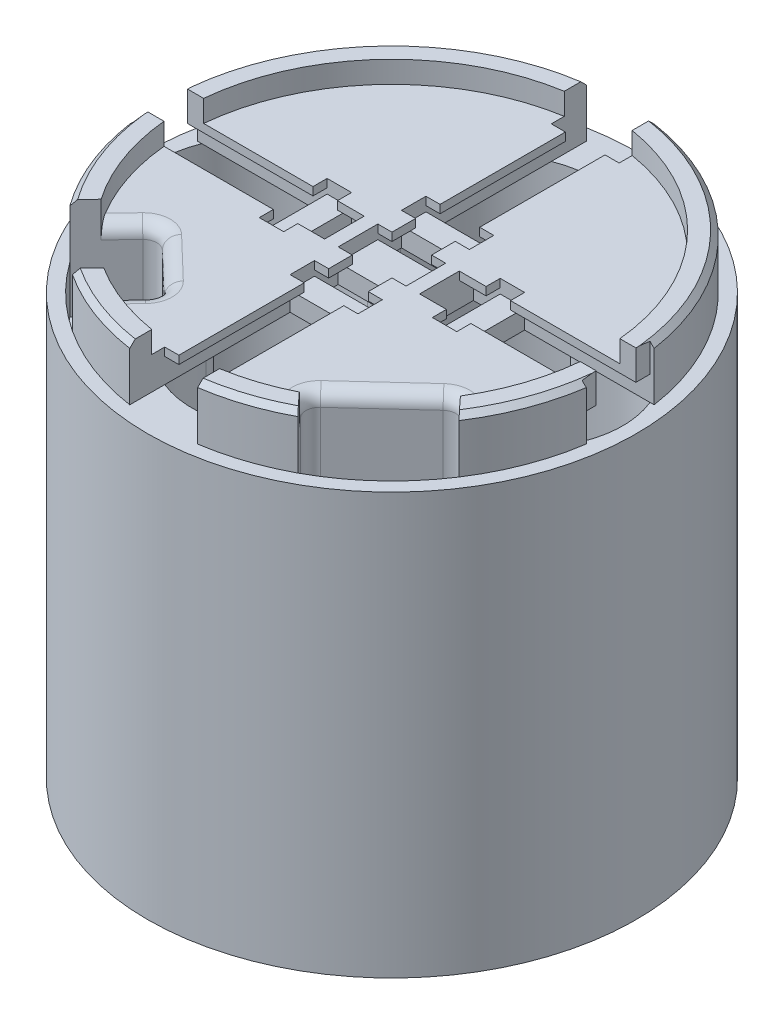
from build123d import *

# Parameters (mm, degrees)
CHAMFER1_SIZE                  = 0.508
CUT_EXTRUDE1_REACH             = 54.93
CUT_EXTRUDE1_DIRECTION_2_REACH = 54.93
CIRPATTERN1_COUNT              = 2
CIRPATTERN1_ANGLE              = 90
CUT_EXTRUDE7_DEPTH             = 36.83
SKETCH12_W                     = 2.286
SKETCH12_H                     = 6.35
SKETCH12_W_2                   = 6.35
SKETCH12_H_2                   = 2.286
BOSS_EXTRUDE2_DEPTH            = 1.778
CIRPATTERN2_COUNT              = 2
BOSS_EXTRUDE3_REACH            = 52.943
SKETCH15_W                     = 1.27
SKETCH15_H                     = 6.35
CIRPATTERN3_COUNT              = 2
CUT_EXTRUDE9_START             = -2.794
SKETCH16_W                     = 2.286
SKETCH16_H                     = 6.35
SKETCH16_W_2                   = 6.35
SKETCH16_H_2                   = 2.286
CUT_EXTRUDE9_DEPTH             = 2.794
CUT_EXTRUDE10_REACH            = 56.963
SKETCH17_W                     = 6.35
SKETCH17_H                     = 3.508817221
SKETCH17_W_2                   = 0.624597149
SKETCH17_H_2                   = 6.35
FILLET2_R                      = 1.27
FILLET3_R                      = 1.27
FILLET4_R                      = 1.27
FILLET5_R                      = 1.27
SKETCH18_W                     = 6.35
SKETCH18_H                     = 3.7084
BOSS_EXTRUDE4_DEPTH            = 1.778
CUT_EXTRUDE11_DEPTH            = 34.29
CUT_EXTRUDE12_DEPTH            = 9.525
CHAMFER2_SIZE                  = 0.508
CHAMFER3_SIZE                  = 0.508
SKETCH23_R                     = 19.558
CUT_EXTRUDE16_DEPTH            = 2.032
FILLET8_R                      = 1.27
FILLET9_R                      = 1.27


with BuildPart() as part:
    # Sketch1 → Revolve1 (revolve)
    with BuildSketch(Plane.XY, mode=Mode.PRIVATE) as revolve1_sk:
        Polygon((0, 0), (21.59, 0), (21.59, -2.54), (22.86, -2.54), (22.86, 36.83), (21.59, 36.83), (21.59, 41.91), (0, 41.91), align=None)
    revolve(revolve1_sk.sketch.rotate(Axis((0, 41.91, 0), (0, -1, 0)), 90), axis=Axis((0, 41.91, 0), (0, -1, 0)))

    # Chamfer1
    chamfer1_edges = [part.edges().sort_by_distance(p)[0] for p in [
        (0, 41.91, -21.59),
    ]]
    chamfer(chamfer1_edges, length=CHAMFER1_SIZE)

    # Sketch3 → Cut-Extrude1 (cut, up to next)
    with BuildSketch(Plane.XY, mode=Mode.PRIVATE) as cut_extrude1_sk1:
        Polygon((0, 36.83), (3.175, 36.83), (3.175, 39.116), (1.8542, 39.116), (1.8542, 41.91), (-1.8542, 41.91), (-1.8542, 39.116), (-3.175, 39.116), (-3.175, 36.83), align=None)
    cut_extrude1_tool1 = extrude(cut_extrude1_sk1.sketch, amount=-CUT_EXTRUDE1_REACH, mode=Mode.PRIVATE) & part.part
    cut_extrude1 = cut_extrude1_tool1.solids().sort_by_distance((0, 39.030894, 0))[0]
    add(cut_extrude1, mode=Mode.SUBTRACT)

    # Sketch3 → Cut-Extrude1 direction 2 (cut, up to next)
    with BuildSketch(Plane.XY, mode=Mode.PRIVATE) as cut_extrude1_direction_2_sk1:
        Polygon((0, 36.83), (3.175, 36.83), (3.175, 39.116), (1.8542, 39.116), (1.8542, 41.91), (-1.8542, 41.91), (-1.8542, 39.116), (-3.175, 39.116), (-3.175, 36.83), align=None)
    cut_extrude1_direction_2_tool1 = extrude(cut_extrude1_direction_2_sk1.sketch, amount=CUT_EXTRUDE1_DIRECTION_2_REACH, mode=Mode.PRIVATE) & part.part
    cut_extrude1_direction_2 = cut_extrude1_direction_2_tool1.solids().sort_by_distance((0, 39.030894, 0))[0]
    add(cut_extrude1_direction_2, mode=Mode.SUBTRACT)

    # CirPattern1: Cut-Extrude1, Cut-Extrude1 direction 2 ×2 about axis
    cirpattern1_axis = Axis((0, 41.91, 0), (0, 1, 0))
    add([cut_extrude1.rotate(cirpattern1_axis, i * CIRPATTERN1_ANGLE / (CIRPATTERN1_COUNT - 1)) for i in range(1, CIRPATTERN1_COUNT)], mode=Mode.SUBTRACT)
    add([cut_extrude1_direction_2.rotate(cirpattern1_axis, i * CIRPATTERN1_ANGLE / (CIRPATTERN1_COUNT - 1)) for i in range(1, CIRPATTERN1_COUNT)], mode=Mode.SUBTRACT)

    # Sketch4 → Cut-Extrude7 (cut)
    with BuildSketch(Plane.XZ):
        with BuildLine():
            ThreePointArc((6.604, 5.161889964), (0, 18.705779928), (-6.604, 5.161889964))
            ThreePointArc((-6.604, 5.161889964), (-21.59, 0), (-6.604, -5.161889964))
            ThreePointArc((-6.604, -5.161889964), (0, -18.705779928), (6.604, -5.161889964))
            ThreePointArc((6.604, -5.161889964), (21.59, 0), (6.604, 5.161889964))
        make_face()
    extrude(amount=-CUT_EXTRUDE7_DEPTH, mode=Mode.SUBTRACT)

    # Sketch12 → Boss-Extrude2 (add)
    with BuildSketch(Plane.XZ.offset(-36.83)):
        with Locations((-8.09625, 0)):
            Rectangle(SKETCH12_W, SKETCH12_H)
        with Locations((0, 5.212029928)):
            Rectangle(SKETCH12_W_2, SKETCH12_H_2)
    boss_extrude2 = extrude(amount=-BOSS_EXTRUDE2_DEPTH)

    # CirPattern2: Boss-Extrude2 ×2 about axis
    cirpattern2_axis = Axis((0, 0, 0), (0, 1, 0))
    for i in range(1, CIRPATTERN2_COUNT):
        add(boss_extrude2.rotate(cirpattern2_axis, i * 360 / CIRPATTERN2_COUNT))

    # Boss-Extrude3: up to this face of the body (flat: up to its plane)
    boss_extrude3_end = Plane(part.part.faces().sort_by_distance((-9.763290549, 41.91, 9.763290549))[0])
    # Sketch15 → Boss-Extrude3 (add, up to the picked face)
    with BuildSketch(Plane.XZ.offset(-36.83), mode=Mode.PRIVATE) as boss_extrude3_sk1:
        with Locations((-3.81, 0)):
            Rectangle(SKETCH15_W, SKETCH15_H)
    boss_extrude3_tool1 = split(extrude(boss_extrude3_sk1.sketch, amount=-BOSS_EXTRUDE3_REACH, mode=Mode.PRIVATE), bisect_by=boss_extrude3_end, keep=Keep.BOTH, mode=Mode.PRIVATE)
    boss_extrude3 = boss_extrude3_tool1.solids().sort_by(Axis((-3.81, 36.83, 0), (0, 1, 0)))[0]
    add(boss_extrude3)

    # CirPattern3: Boss-Extrude3 ×2 about axis
    cirpattern3_axis = Axis((0, 41.91, 0), (0, 1, 0))
    for i in range(1, CIRPATTERN3_COUNT):
        add(boss_extrude3.rotate(cirpattern3_axis, i * 360 / CIRPATTERN3_COUNT))

    # Sketch16 → Cut-Extrude9 (cut)
    with BuildSketch(Plane(origin=(0, 41.91, 0), x_dir=(1, 0, 0), z_dir=(0, 1, 0)).offset(CUT_EXTRUDE9_START)):
        with Locations((8.09625, 0)):
            Rectangle(SKETCH16_W, SKETCH16_H)
        with Locations((0, -5.212029928)):
            Rectangle(SKETCH16_W_2, SKETCH16_H_2)
        with Locations((-8.09625, 0)):
            Rectangle(SKETCH16_W, SKETCH16_H)
        with Locations((0, 5.212029928)):
            Rectangle(SKETCH16_W_2, SKETCH16_H_2)
    extrude(amount=CUT_EXTRUDE9_DEPTH, mode=Mode.SUBTRACT)

    # Sketch17 → Cut-Extrude10 (cut, up to next)
    with BuildSketch(Plane(origin=(0, 41.91, 0), x_dir=(1, 0, 0), z_dir=(0, 1, 0)), mode=Mode.PRIVATE) as cut_extrude10_sk1:
        with Locations((0, 19.83559139)):
            Rectangle(SKETCH17_W, SKETCH17_H)
    cut_extrude10_tool1 = extrude(cut_extrude10_sk1.sketch, amount=-CUT_EXTRUDE10_REACH, mode=Mode.PRIVATE) & part.part
    # Sketch17 → Cut-Extrude10 (cut, up to next)
    with BuildSketch(Plane(origin=(0, 41.91, 0), x_dir=(1, 0, 0), z_dir=(0, 1, 0)), mode=Mode.PRIVATE) as cut_extrude10_sk2:
        with Locations((0, -19.83559139)):
            Rectangle(SKETCH17_W, SKETCH17_H)
    cut_extrude10_tool2 = extrude(cut_extrude10_sk2.sketch, amount=-CUT_EXTRUDE10_REACH, mode=Mode.PRIVATE) & part.part
    # Sketch17 → Cut-Extrude10 (cut, up to next)
    with BuildSketch(Plane(origin=(0, 41.91, 0), x_dir=(1, 0, 0), z_dir=(0, 1, 0)), mode=Mode.PRIVATE) as cut_extrude10_sk3:
        with Locations((-21.277701425, 0)):
            Rectangle(SKETCH17_W_2, SKETCH17_H_2)
    cut_extrude10_tool3 = extrude(cut_extrude10_sk3.sketch, amount=-CUT_EXTRUDE10_REACH, mode=Mode.PRIVATE) & part.part
    # Sketch17 → Cut-Extrude10 (cut, up to next)
    with BuildSketch(Plane(origin=(0, 41.91, 0), x_dir=(1, 0, 0), z_dir=(0, 1, 0)), mode=Mode.PRIVATE) as cut_extrude10_sk4:
        with Locations((21.277701425, 0)):
            Rectangle(SKETCH17_W_2, SKETCH17_H_2)
    cut_extrude10_tool4 = extrude(cut_extrude10_sk4.sketch, amount=-CUT_EXTRUDE10_REACH, mode=Mode.PRIVATE) & part.part
    add(cut_extrude10_tool1.solids().sort_by_distance((0, 41.91, -19.835591))[0], mode=Mode.SUBTRACT)
    add(cut_extrude10_tool1.solids().sort_by_distance((0, 41.91, -19.835591))[1], mode=Mode.SUBTRACT)
    add(cut_extrude10_tool2.solids().sort_by_distance((0, 41.91, 19.835591))[0], mode=Mode.SUBTRACT)
    add(cut_extrude10_tool2.solids().sort_by_distance((0, 41.91, 19.835591))[1], mode=Mode.SUBTRACT)
    add(cut_extrude10_tool3.solids().sort_by_distance((-21.277701, 41.91, 0))[0], mode=Mode.SUBTRACT)
    add(cut_extrude10_tool3.solids().sort_by_distance((-21.277701, 41.91, 0))[1], mode=Mode.SUBTRACT)
    add(cut_extrude10_tool4.solids().sort_by_distance((21.277701, 41.91, 0))[0], mode=Mode.SUBTRACT)
    add(cut_extrude10_tool4.solids().sort_by_distance((21.277701, 41.91, 0))[1], mode=Mode.SUBTRACT)

    # Fillet2
    fillet2_edges = [part.edges().sort_by_distance(p)[0] for p in [
        (6.604, 18.415, 5.161889964),
    ]]
    fillet(fillet2_edges, radius=FILLET2_R)

    # Fillet3
    fillet3_edges = [part.edges().sort_by_distance(p)[0] for p in [
        (6.604, 18.415, -5.161889964),
    ]]
    fillet(fillet3_edges, radius=FILLET3_R)

    # Fillet4
    fillet4_edges = [part.edges().sort_by_distance(p)[0] for p in [
        (-6.604, 18.415, 5.161889964),
    ]]
    fillet(fillet4_edges, radius=FILLET4_R)

    # Fillet5
    fillet5_edges = [part.edges().sort_by_distance(p)[0] for p in [
        (-6.604, 18.415, -5.161889964),
    ]]
    fillet(fillet5_edges, radius=FILLET5_R)

    # Sketch18 → Boss-Extrude4 (add)
    with BuildSketch(Plane.XZ.offset(-36.83)):
        Rectangle(SKETCH18_W, SKETCH18_H)
    extrude(amount=-BOSS_EXTRUDE4_DEPTH)

    # Sketch19 → Cut-Extrude11 (cut)
    with BuildSketch(Plane(origin=(0, 41.91, 0), x_dir=(1, 0, 0), z_dir=(0, 1, 0))):
        with BuildLine():
            Line((18.08056575, -11.799205149), (15.503216477, -8.993252419))
            ThreePointArc((15.503216477, -8.993252419), (14.621781251, -8.583512393), (13.708782475, -8.917051267))
            Line((13.708782475, -8.917051267), (7.722749985, -14.415396385))
            ThreePointArc((7.722749985, -14.415396385), (7.313009959, -15.29683161), (7.646548833, -16.209830386))
            Line((7.646548833, -16.209830386), (10.223898107, -19.015783115))
            ThreePointArc((10.223898107, -19.015783115), (14.604979218, -15.900398802), (18.08056575, -11.799205149))
        make_face()
    extrude(amount=-CUT_EXTRUDE11_DEPTH, mode=Mode.SUBTRACT)

    # Sketch20 → Cut-Extrude12 (cut)
    with BuildSketch(Plane(origin=(0, 41.91, 0), x_dir=(1, 0, 0), z_dir=(0, 1, 0))):
        with BuildLine():
            Line((-17.525588381, -12.608800573), (-14.187738257, -9.12325434))
            ThreePointArc((-14.187738257, -9.12325434), (-13.297972648, -8.731933363), (-12.392107636, -9.084386943))
            Line((-12.392107636, -9.084386943), (-8.539661799, -12.773589712))
            ThreePointArc((-8.539661799, -12.773589712), (-8.148340823, -13.663355321), (-8.500794402, -14.569220333))
            Line((-8.500794402, -14.569220333), (-11.838644527, -18.054766566))
            ThreePointArc((-11.838644527, -18.054766566), (-14.932487401, -15.593233148), (-17.525588381, -12.608800573))
        make_face()
    extrude(amount=-CUT_EXTRUDE12_DEPTH, mode=Mode.SUBTRACT)

    # Chamfer2
    chamfer2_edges = [part.edges().sort_by_distance(p)[0] for p in [
        (0, -2.54, -21.59),
    ]]
    chamfer(chamfer2_edges, length=CHAMFER2_SIZE)

    # Chamfer3
    # the kernel refuses this chamfer: 0.508 mm, written as the material it takes off along each edge
    with BuildSketch(Plane(origin=(-13.208, 0, 0), x_dir=(-1.0, 0, 2.2667393029527525e-09), z_dir=(2.2667393029527525e-09, 0, 1.0))) as chamfer3_piece_1_section:
        Polygon((8.382 + CHAMFER3_SIZE, 0), (8.382, -CHAMFER3_SIZE), (8.382, 0), align=None)
    chamfer3_piece_1 = revolve(axis=Axis((-13.208, 0, 0), (0, -1, 0)), revolution_arc=112.263391438, mode=Mode.PRIVATE)
    chamfer3_piece_1 = chamfer3_piece_1 & Plane(origin=(0, 0, 0), x_dir=(0, 0, 1), z_dir=(0, -1, 0)) * Cylinder(21.59, 36, mode=Mode.PRIVATE)
    add(chamfer3_piece_1, mode=Mode.SUBTRACT)
    with BuildSketch(Plane(origin=(13.208, 0, 0), x_dir=(1.0, 0, -2.604682290791187e-09), z_dir=(-2.604682290791187e-09, 0, -1.0))) as chamfer3_piece_2_section:
        Polygon((8.382 + CHAMFER3_SIZE, 0), (8.382, -CHAMFER3_SIZE), (8.382, 0), align=None)
    chamfer3_piece_2 = revolve(axis=Axis((13.208, 0, 0), (0, -1, 0)), revolution_arc=112.263391458, mode=Mode.PRIVATE)
    chamfer3_piece_2 = chamfer3_piece_2 & Plane(origin=(0, 0, 0), x_dir=(0, 0, 1), z_dir=(0, -1, 0)) * Cylinder(21.59, 36, mode=Mode.PRIVATE)
    add(chamfer3_piece_2, mode=Mode.SUBTRACT)
    with BuildSketch(Plane(origin=(0, 0, 10.323779928), x_dir=(0.9895561260519603, 0, -0.14414809535001394), z_dir=(-0.14414809535001394, 0, -0.9895561260519603))) as chamfer3_piece_3:
        Polygon((8.382 + CHAMFER3_SIZE, 0), (8.382, -CHAMFER3_SIZE), (8.382, 0), align=None)
    revolve(axis=Axis((0, 0, 10.323779928), (0, -1, 0)), revolution_arc=196.575900794, mode=Mode.SUBTRACT)
    with BuildSketch(Plane(origin=(9.551195716, 0, 8.932462496), x_dir=(-0.9895561240627598, 0, 0.14414810900559177), z_dir=(0.14414810900559177, 0, 0.9895561240627598))) as chamfer3_piece_4:
        Polygon((1.26999999 - CHAMFER3_SIZE, 0), (1.26999999 - CHAMFER3_SIZE * 2.0028947442e-08, -CHAMFER3_SIZE * 0.999999979971), (1.26999999, 0), align=None)
    revolve(axis=Axis((9.551195716, 0, 8.932462496), (0, -1, 0)), revolution_arc=120.551343287, mode=Mode.SUBTRACT)
    with BuildSketch(Plane(origin=(13.208, 0, 0), x_dir=(-0.3788649265796168, 0, -0.9254519800658604), z_dir=(-0.9254519800658604, 0, 0.3788649265796168))) as chamfer3_piece_5_section:
        Polygon((8.382 + CHAMFER3_SIZE, 0), (8.382, -CHAMFER3_SIZE), (8.382, 0), align=None)
    chamfer3_piece_5 = revolve(axis=Axis((13.208, 0, 0), (0, -1, 0)), revolution_arc=112.263391159, mode=Mode.PRIVATE)
    chamfer3_piece_5 = chamfer3_piece_5 & Plane(origin=(0, 0, 0), x_dir=(0, 0, 1), z_dir=(0, -1, 0)) * Cylinder(21.59, 36, mode=Mode.PRIVATE)
    add(chamfer3_piece_5, mode=Mode.SUBTRACT)
    with BuildSketch(Plane(origin=(9.551195716, 0, -8.932462496), x_dir=(0.37886493935057053, 0, 0.9254519748376403), z_dir=(0.9254519748376403, 0, -0.37886493935057053))) as chamfer3_piece_6:
        Polygon((1.26999999 - CHAMFER3_SIZE, 0), (1.26999999 - CHAMFER3_SIZE * 2.00289553097e-08, -CHAMFER3_SIZE * 0.999999979971), (1.26999999, 0), align=None)
    revolve(axis=Axis((9.551195716, 0, -8.932462496), (0, -1, 0)), revolution_arc=120.551343287, mode=Mode.SUBTRACT)
    with BuildSketch(Plane(origin=(-13.208, 0, 0), x_dir=(0.3788649265796168, 0, 0.9254519800658604), z_dir=(0.9254519800658604, 0, -0.3788649265796168))) as chamfer3_piece_7_section:
        Polygon((8.382 + CHAMFER3_SIZE, 0), (8.382, -CHAMFER3_SIZE), (8.382, 0), align=None)
    chamfer3_piece_7 = revolve(axis=Axis((-13.208, 0, 0), (0, -1, 0)), revolution_arc=112.263391179, mode=Mode.PRIVATE)
    chamfer3_piece_7 = chamfer3_piece_7 & Plane(origin=(0, 0, 0), x_dir=(0, 0, 1), z_dir=(0, -1, 0)) * Cylinder(21.59, 36, mode=Mode.PRIVATE)
    add(chamfer3_piece_7, mode=Mode.SUBTRACT)
    with BuildSketch(Plane(origin=(-9.551195716, 0, 8.932462496), x_dir=(0.98955612406276, 0, 0.14414810900558978), z_dir=(-0.14414810900558978, 0, 0.98955612406276))) as chamfer3_piece_8:
        Polygon((1.26999999 - CHAMFER3_SIZE, 0), (1.26999999 - CHAMFER3_SIZE * 2.00289509387e-08, CHAMFER3_SIZE * 0.999999979971), (1.26999999, 0), align=None)
    revolve(axis=Axis((-9.551195716, 0, 8.932462496), (0, 1, 0)), revolution_arc=120.551343287, mode=Mode.SUBTRACT)
    with BuildSketch(Plane(origin=(0, 0, -10.323779928), x_dir=(-0.9895561260519603, 0, 0.14414809535001416), z_dir=(0.14414809535001416, 0, 0.9895561260519603))) as chamfer3_piece_9:
        Polygon((8.382 + CHAMFER3_SIZE, 0), (8.382, -CHAMFER3_SIZE), (8.382, 0), align=None)
    revolve(axis=Axis((0, 0, -10.323779928), (0, -1, 0)), revolution_arc=196.575900794, mode=Mode.SUBTRACT)
    with BuildSketch(Plane(origin=(-9.551195716, 0, -8.932462496), x_dir=(-0.3788649393505754, 0, 0.9254519748376383), z_dir=(-0.9254519748376383, 0, -0.3788649393505754))) as chamfer3_piece_10:
        Polygon((1.26999999 - CHAMFER3_SIZE, 0), (1.26999999 - CHAMFER3_SIZE * 2.00289513758e-08, CHAMFER3_SIZE * 0.999999979971), (1.26999999, 0), align=None)
    revolve(axis=Axis((-9.551195716, 0, -8.932462496), (0, 1, 0)), revolution_arc=120.551343287, mode=Mode.SUBTRACT)

    # Sketch23 → Cut-Extrude16 (cut)
    with BuildSketch(Plane(origin=(0, 41.91, 0), x_dir=(1, 0, 0), z_dir=(0, 1, 0))):
        Circle(SKETCH23_R)
    extrude(amount=-CUT_EXTRUDE16_DEPTH, mode=Mode.SUBTRACT)

    # Fillet8
    fillet8_edges = [part.edges().sort_by_distance(p)[0] for p in [
        (-9.453749368, 39.878, 15.564342483),
        (-15.140693222, 39.878, 10.118376489),
        (-13.297972648, 39.878, 8.731933363),
        (-10.465884718, 39.878, 10.928988328),
        (-8.148340823, 39.878, 13.663355321),
    ]]
    fillet(fillet8_edges, radius=FILLET8_R)

    # Fillet9
    fillet9_edges = [part.edges().sort_by_distance(p)[0] for p in [
        (8.223531045, 39.878, 16.837989257),
        (7.313009959, 39.878, 15.29683161),
        (10.71576623, 39.878, 11.666223826),
        (14.621781251, 39.878, 8.583512393),
        (16.080198688, 39.878, 9.621411291),
    ]]
    fillet(fillet9_edges, radius=FILLET9_R)


solid = part.part
